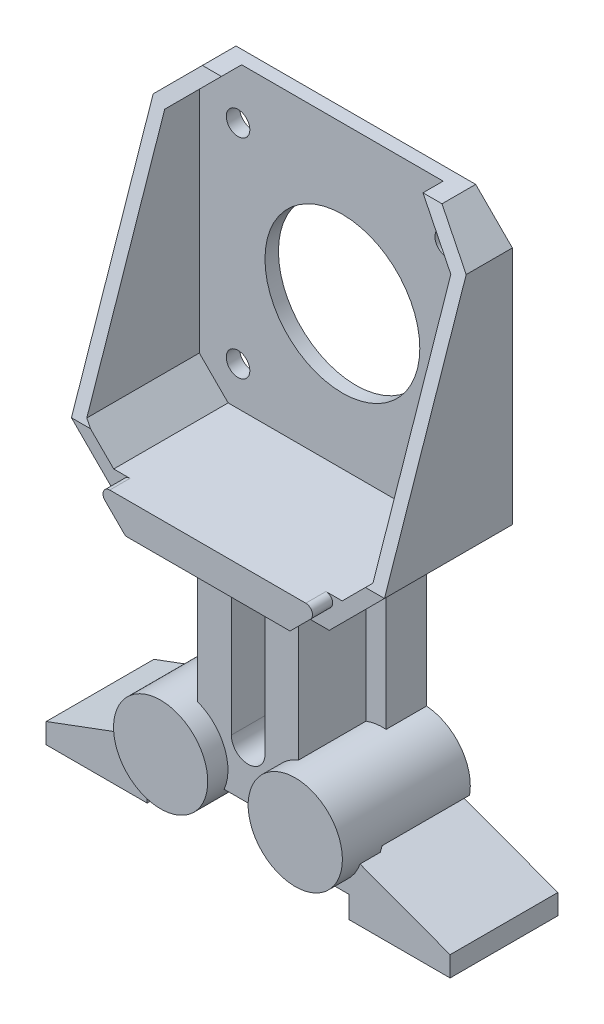
from build123d import *

# Parameters (mm, degrees)
SKETCH3_R               = 11.5
SKETCH3_R_2             = 1.75
BOSS_EXTRUDE1_DEPTH     = 19
CUT_EXTRUDE1_START      = 19
SKETCH3_3_R             = 11.5
SKETCH3_3_R_2           = 1.75
CUT_EXTRUDE1_DEPTH      = 17
SKETCH3_4_R             = 1.75
SKETCH3_4_R_2           = 11.5
CUT_EXTRUDE3_DEPTH      = 38.975320933
CUT_EXTRUDE7_DEPTH      = 38.975320933
CUT_EXTRUDE7_DEPTH_BACK = 38.975320933
CUT_EXTRUDE8_DEPTH      = 38.015199581
BOSS_EXTRUDE4_DEPTH     = 19
BOSS_EXTRUDE5_START     = 19
BOSS_EXTRUDE5_DEPTH     = 3
BOSS_EXTRUDE6_DEPTH     = 6
BOSS_EXTRUDE7_START     = -6
BOSS_EXTRUDE7_DEPTH     = 16
SKETCH14_R              = 7
BOSS_EXTRUDE8_DEPTH     = 3
SKETCH15_R              = 3
CUT_EXTRUDE10_DEPTH     = 13


# Read off the part's stored shape, not the designer's step: Boss-Extrude7
with BuildPart() as part:
    # Sketch3 → Boss-Extrude1 (new body)
    # profile 1 of 7: a face of its own
    with BuildSketch(Plane.XY):
        Polygon((-23.25, 17.798989873), (-17.798989873, 23.25), (17.798989873, 23.25), (23.25, 17.798989873), (23.25, -17.798989873), (17.798989873, -23.25), (-17.798989873, -23.25), (-23.25, -17.798989873), align=None)
        Polygon((21.25, 16.970562748), (16.970562748, 21.25), (-16.970562748, 21.25), (-21.25, 16.970562748), (-21.25, -16.970562748), (-16.970562748, -21.25), (16.970562748, -21.25), (21.25, -16.970562748), align=None, mode=Mode.SUBTRACT)
    # profile 2 of 7: a face of its own
    with BuildSketch(Plane.XY):
        Polygon((21.25, 16.970562748), (21.25, -16.970562748), (16.970562748, -21.25), (-16.970562748, -21.25), (-21.25, -16.970562748), (-21.25, 16.970562748), (-16.970562748, 21.25), (16.970562748, 21.25), align=None)
        Circle(SKETCH3_R, mode=Mode.SUBTRACT)
        with Locations((-15.5, -15.5)):
            Circle(SKETCH3_R_2, mode=Mode.SUBTRACT)
        with Locations((15.5, -15.5)):
            Circle(SKETCH3_R_2, mode=Mode.SUBTRACT)
        with Locations((15.5, 15.5)):
            Circle(SKETCH3_R_2, mode=Mode.SUBTRACT)
        with Locations((-15.5, 15.5)):
            Circle(SKETCH3_R_2, mode=Mode.SUBTRACT)
    # profile 3 of 7: a face of its own
    with BuildSketch(Plane.XY):
        with Locations((-15.5, 15.5)):
            Circle(SKETCH3_R_2)
    # profile 4 of 7: a face of its own
    with BuildSketch(Plane.XY):
        with Locations((15.5, 15.5)):
            Circle(SKETCH3_R_2)
    # profile 5 of 7: a face of its own
    with BuildSketch(Plane.XY):
        with Locations((15.5, -15.5)):
            Circle(SKETCH3_R_2)
    # profile 6 of 7: a face of its own
    with BuildSketch(Plane.XY):
        with Locations((-15.5, -15.5)):
            Circle(SKETCH3_R_2)
    # profile 7 of 7: a face of its own
    with BuildSketch(Plane.XY):
        Circle(SKETCH3_R)
    extrude(amount=BOSS_EXTRUDE1_DEPTH)

    # Sketch3<3> → Cut-Extrude1 (cut)
    with BuildSketch(Plane.XY.offset(CUT_EXTRUDE1_START)):
        Polygon((21.25, 16.970562748), (21.25, -16.970562748), (16.970562748, -21.25), (-16.970562748, -21.25), (-21.25, -16.970562748), (-21.25, 16.970562748), (-16.970562748, 21.25), (16.970562748, 21.25), align=None)
        Circle(SKETCH3_3_R, mode=Mode.SUBTRACT)
        with Locations((-15.5, -15.5)):
            Circle(SKETCH3_3_R_2, mode=Mode.SUBTRACT)
        with Locations((15.5, -15.5)):
            Circle(SKETCH3_3_R_2, mode=Mode.SUBTRACT)
        with Locations((15.5, 15.5)):
            Circle(SKETCH3_3_R_2, mode=Mode.SUBTRACT)
        with Locations((-15.5, 15.5)):
            Circle(SKETCH3_3_R_2, mode=Mode.SUBTRACT)
    extrude(amount=-CUT_EXTRUDE1_DEPTH, mode=Mode.SUBTRACT)

    # Sketch3<4> → Cut-Extrude3 (cut, through all)
    with BuildSketch(Plane.XY):
        with Locations(Location((-15.5, 15.5, 0), (0, 0, 180))):
            Circle(SKETCH3_4_R)
        with Locations(Location((15.5, 15.5, 0), (0, 0, 180))):
            Circle(SKETCH3_4_R)
        with Locations(Location((-15.5, -15.5, 0), (0, 0, 180))):
            Circle(SKETCH3_4_R)
        with Locations(Location((0, 0, 0), (0, 0, 180))):
            Circle(SKETCH3_4_R_2)
        with Locations(Location((15.5, -15.5, 0), (0, 0, 180))):
            Circle(SKETCH3_4_R)
    extrude(amount=CUT_EXTRUDE3_DEPTH, mode=Mode.SUBTRACT)

    # Sketch6 → Cut-Extrude7 (cut, two sides: drawn at the far end of the back side and taken through both)
    with BuildSketch(Plane(origin=(0, 0, 0), x_dir=(0, 0, -1), z_dir=(1, 0, 0)).offset(-CUT_EXTRUDE7_DEPTH_BACK)):
        Polygon((-19, 23.25), (-5, 23.25), (-19, -17.798989873), align=None)
    extrude(amount=CUT_EXTRUDE7_DEPTH + CUT_EXTRUDE7_DEPTH_BACK, mode=Mode.SUBTRACT)

    # Sketch8 → Cut-Extrude8 (cut, through all)
    with BuildSketch(Plane.XY.offset(2)):
        Polygon((-16.970562748, 21.25), (-14.970562748, 23.25), (14.970562748, 23.25), (16.970562748, 21.25), align=None)
    extrude(amount=CUT_EXTRUDE8_DEPTH, mode=Mode.SUBTRACT)

    # Sketch10 → Boss-Extrude4 (add)
    with BuildSketch(Plane.XY):
        Polygon((19.798989873, -21.25), (-19.798989873, -21.25), (-15.048989873, -26), (15.048989873, -26), align=None)
    extrude(amount=BOSS_EXTRUDE4_DEPTH)

    # Sketch11 → Boss-Extrude5 (add)
    with BuildSketch(Plane.XY.offset(BOSS_EXTRUDE5_START)):
        with BuildLine():
            Line((-14.556349186, -21.25), (14.556349186, -21.25))
            ThreePointArc((14.556349186, -21.25), (15.480228719, -21.867316568), (15.263455967, -22.957106781))
            Line((15.263455967, -22.957106781), (12.220562748, -26))
            Line((12.220562748, -26), (-12.220562748, -26))
            Line((-12.220562748, -26), (-15.263455967, -22.957106781))
            ThreePointArc((-15.263455967, -22.957106781), (-15.480228719, -21.867316568), (-14.556349186, -21.25))
        make_face()
    extrude(amount=BOSS_EXTRUDE5_DEPTH)


with BuildPart() as body_2:
    # Sketch12 → Boss-Extrude6 (new body)
    with BuildSketch(Plane.XY):
        with BuildLine():
            Line((2.5, -28.5), (2.5, -49.75))
            ThreePointArc((2.5, -49.75), (1.767766953, -51.517766953), (0, -52.25))
            Line((0, -52.25), (0, -57.25))
            Line((0, -57.25), (10.5, -57.25))
            Line((10.5, -57.25), (10.5, -30.548989873))
            Line((10.5, -30.548989873), (15.048989873, -26))
            Line((15.048989873, -26), (0, -26))
            ThreePointArc((0, -26), (1.767766953, -26.732233047), (2.5, -28.5))
        make_face()
    extrude(amount=BOSS_EXTRUDE6_DEPTH)

    # Boss-Extrude7 outline → Boss-Extrude7 (add)
    with BuildSketch(Plane.XY.offset(6).offset(BOSS_EXTRUDE7_START)):
        with BuildLine():
            Line((7.5, -26), (0, -26))
            ThreePointArc((0, -26), (1.767766953, -26.732233047), (2.5, -28.5))
            Line((2.5, -28.5), (2.5, -49.75))
            ThreePointArc((2.5, -49.75), (1.767766953, -51.517766953), (0, -52.25))
            Line((0, -52.25), (0, -57.25))
            Line((0, -57.25), (3.562803405, -57.25))
            ThreePointArc((3.562803405, -57.25), (6.143187845, -60.341660723), (10, -61.5))
            Line((10, -61.5), (15, -61.5))
            Line((15, -61.5), (15, -64.75))
            Line((15, -64.75), (30, -64.75))
            Line((30, -64.75), (30, -61.75))
            Line((30, -61.75), (16.619881116, -56.775340415))
            ThreePointArc((16.619881116, -56.775340415), (14.864528014, -49.466475668), (7.5, -47.961651585))
            Line((7.5, -47.961651585), (7.5, -26))
        make_face()
    extrude(amount=BOSS_EXTRUDE7_DEPTH)

    # Sketch14 → Boss-Extrude8 (add)
    with BuildSketch(Plane.XY.offset(16)):
        with Locations((10, -54.5)):
            Circle(SKETCH14_R)
    extrude(amount=BOSS_EXTRUDE8_DEPTH)

    # Sketch15 → Cut-Extrude10 (cut)
    with BuildSketch(Plane.XY):
        with Locations((10, -54.5)):
            Circle(SKETCH15_R)
        with BuildLine():
            Line((16.866218411, -56.866927358), (17.214706637, -55.9296142))
            Line((17.214706637, -55.9296142), (12.996797424, -54.361417185))
            ThreePointArc((12.996797424, -54.361417185), (12.999199249, -54.430690092), (13, -54.5))
            ThreePointArc((13, -54.5), (12.966794868, -54.94511595), (12.867914527, -55.380378478))
            Line((12.867914527, -55.380378478), (16.866218411, -56.866927358))
        make_face()
    extrude(amount=CUT_EXTRUDE10_DEPTH, mode=Mode.SUBTRACT)


with BuildPart() as body_3:
    # Mirror1: mirrored copy
    add(body_2.part.mirror(Plane(origin=(0, 0, 0), x_dir=(0, 0, 1), z_dir=(1, 0, 0))))


with BuildPart() as body_2_1:
    add(body_2.part)

    # Combine1: union body 3, part
    add(body_3.part)
    add(part.part)


solid = body_2_1.part
